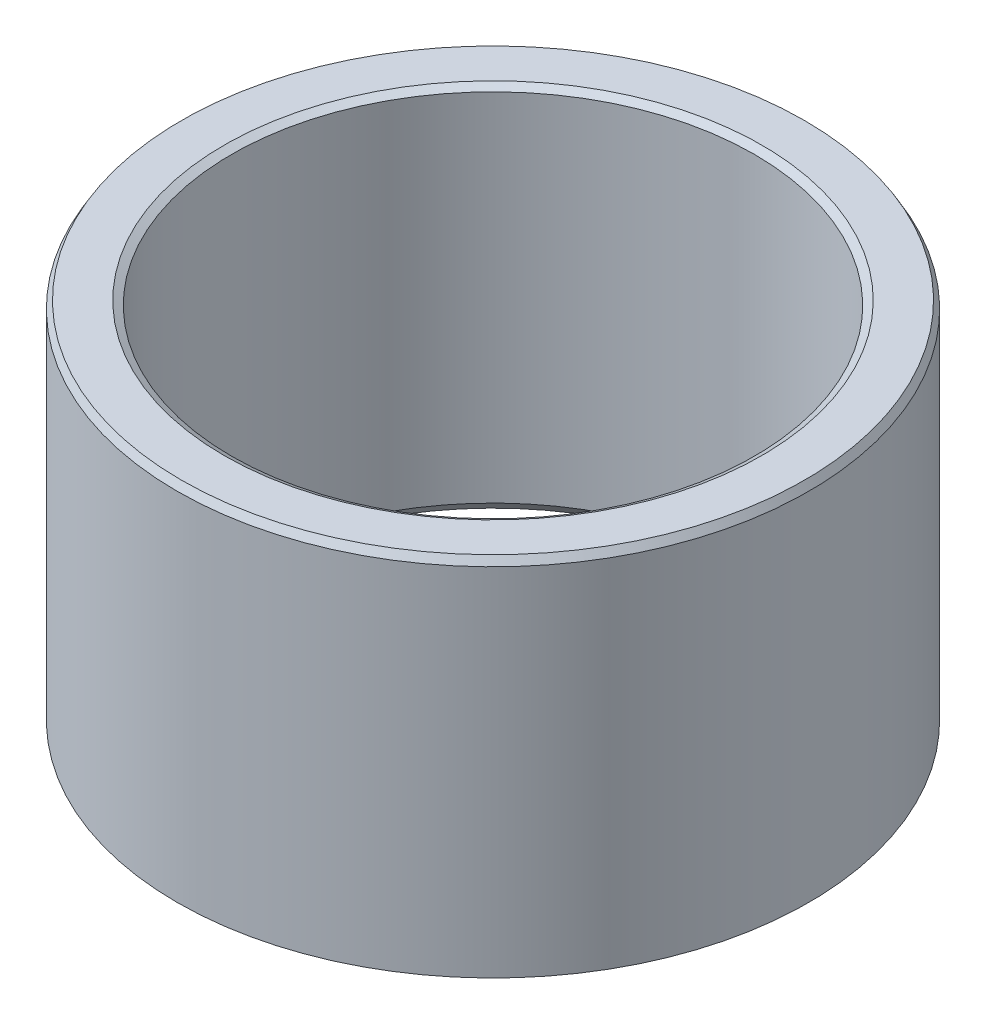
from build123d import *
from OCP.BRepFilletAPI import BRepFilletAPI_MakeChamfer

# Parameters (mm, degrees)
SKETCH1_R           = 45
BOSS_EXTRUDE1_DEPTH = 52.414464059
SKETCH2_R           = 37.250254887
CUT_EXTRUDE1_DEPTH  = 83.44559444
CHAMFER1_SIZE       = 1.060601826
CHAMFER1_SIZE2      = 0.61233875


with BuildPart() as part:
    # Sketch1 → Boss-Extrude1 (new body)
    with BuildSketch(Plane(origin=(0, 0, 0), x_dir=(1, 0, 0), z_dir=(0, 1, 0))):
        Circle(SKETCH1_R)
    extrude(amount=BOSS_EXTRUDE1_DEPTH)

    # Sketch2 → Cut-Extrude1 (cut, through all)
    with BuildSketch(Plane(origin=(0, 0, 0), x_dir=(1, 0, 0), z_dir=(0, 1, 0))):
        Circle(SKETCH2_R)
    extrude(amount=CUT_EXTRUDE1_DEPTH, mode=Mode.SUBTRACT)

    # Chamfer1: one chamfer whose edges measure the first distance from different faces: ONE call of the kernel's chamfer builder (chamfer() names one face for all edges)
    chamfer1_edges_1 = [part.edges().sort_by_distance(p)[0] for p in [
        (-37.250254887, 52.414464059, 0),
    ]]
    chamfer1_side_1 = [part.faces().sort_by_distance(p)[0] for p in [
        (-43.727207794, 52.414464059, 0),
    ]]
    chamfer1_edges_2 = [part.edges().sort_by_distance(p)[0] for p in [
        (-37.250254887, 0, 0),
    ]]
    chamfer1_side_2 = [part.faces().sort_by_distance(p)[0] for p in [
        (-37.250254887, 26.207232029, 0),
    ]]
    chamfer1_edges_3 = [part.edges().sort_by_distance(p)[0] for p in [
        (-45, 0, 0),
    ]]
    chamfer1_side_3 = [part.faces().sort_by_distance(p)[0] for p in [
        (-43.727207794, 0, 0),
    ]]
    chamfer1_edges_4 = [part.edges().sort_by_distance(p)[0] for p in [
        (-45, 52.414464059, 0),
    ]]
    chamfer1_side_4 = [part.faces().sort_by_distance(p)[0] for p in [
        (-45, 26.207232029, 0),
    ]]
    chamfer1 = BRepFilletAPI_MakeChamfer(part.part.solid().wrapped)
    for e in chamfer1_edges_1:
        chamfer1.Add(CHAMFER1_SIZE, CHAMFER1_SIZE2, e.wrapped, chamfer1_side_1[0].wrapped)  # the first distance lies on this face
    for e in chamfer1_edges_2:
        chamfer1.Add(CHAMFER1_SIZE, CHAMFER1_SIZE2, e.wrapped, chamfer1_side_2[0].wrapped)  # the first distance lies on this face
    for e in chamfer1_edges_3:
        chamfer1.Add(CHAMFER1_SIZE, CHAMFER1_SIZE2, e.wrapped, chamfer1_side_3[0].wrapped)  # the first distance lies on this face
    for e in chamfer1_edges_4:
        chamfer1.Add(CHAMFER1_SIZE, CHAMFER1_SIZE2, e.wrapped, chamfer1_side_4[0].wrapped)  # the first distance lies on this face
    add(Compound.cast(chamfer1.Shape()), mode=Mode.REPLACE)


solid = part.part
